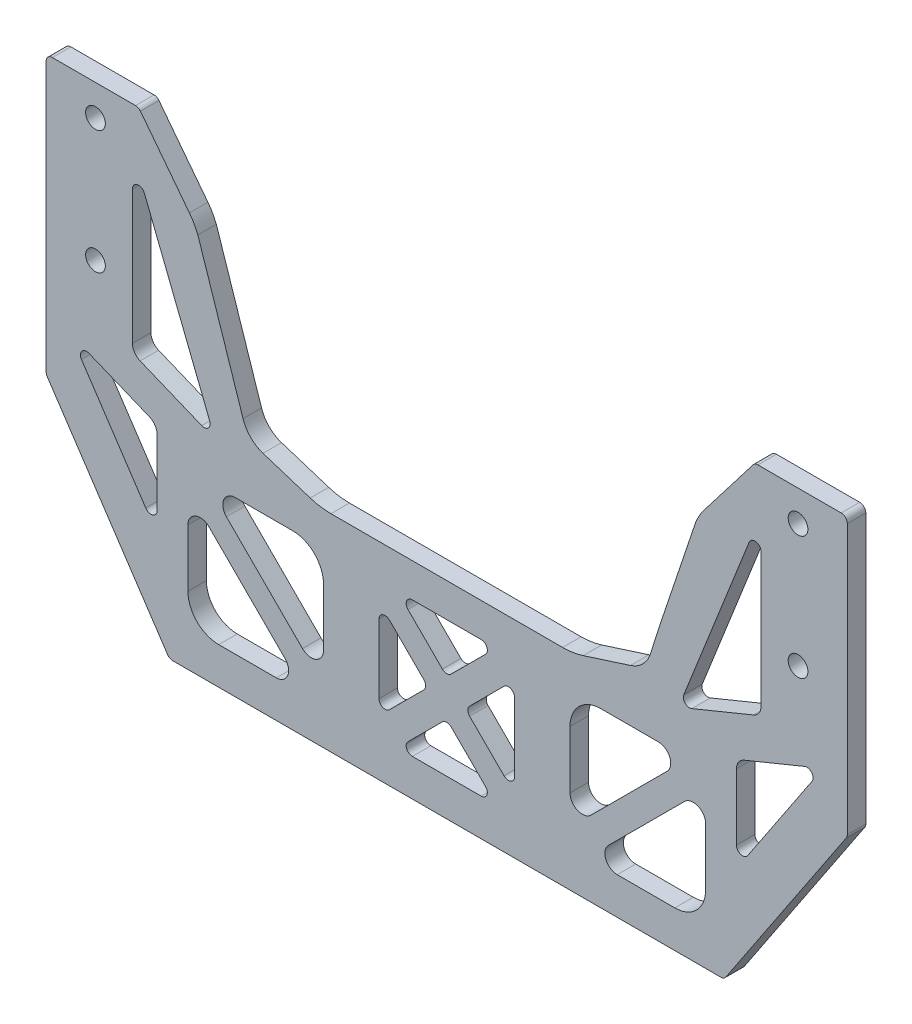
from build123d import *

# Parameters (mm, degrees)
SKETCH_1_W              = 130
SKETCH_1_H              = 75
EXTRUDE_1_DEPTH         = 3
CHAMFER_1_SIZE          = 20
CHAMFER_1_SIZE2         = 30
CHAMFER_2_SIZE          = 30
CHAMFER_2_SIZE2         = 20
SKETCH_2_R              = 1.6
CUT_EXTRUDE_1_DEPTH     = 76.101597853
CUT_EXTRUDE_2_DEPTH     = 76.101597853
CHAMFER_3_SIZE          = 10
FILLET_2_R              = 5
CUT_EXTRUDE_6_DEPTH     = 10
FILLET_5_R              = 10
SKETCH_11_W             = 22
SKETCH_11_H             = 22
CUT_EXTRUDE_7_DEPTH     = 10
FILLET_6_R              = 5
EXTRUDE_2_DEPTH         = 3
FILLET_7_R              = 1
CUT_EXTRUDE_8_DEPTH     = 10
FILLET_8_R              = 1
FILLET_9_R              = 2
FILLET_8_OF_MIRROR_1_R  = 1
FILLET_9_OF_MIRROR_1_R  = 2
EXTRUDE_3_DEPTH         = 3
FILLET_10_DEPTH         = 3
CUT_EXTRUDE_9_DEPTH     = 10
FILLET_11_R             = 4
FILLET_11_OF_MIRROR_3_R = 4
FILLET_12_R             = 1
CUT_EXTRUDE_10_DEPTH    = 10
CUT_EXTRUDE_11_DEPTH    = 10


with BuildPart() as part:
    # 草图1 → 凸台-拉伸1 (new body)
    with BuildSketch(Plane.XY):
        Rectangle(SKETCH_1_W, SKETCH_1_H)
    extrude(amount=EXTRUDE_1_DEPTH)

    # 倒角1
    chamfer_1_edges = [part.edges().sort_by_distance(p)[0] for p in [
        (65, -37.5, 1.5),
    ]]
    chamfer_1_side = [part.faces().sort_by_distance(p)[0] for p in [
        (0, -37.5, 1.5),
    ]]
    chamfer(chamfer_1_edges, length=CHAMFER_1_SIZE, length2=CHAMFER_1_SIZE2, reference=chamfer_1_side[0])

    # 倒角2
    chamfer_2_edges = [part.edges().sort_by_distance(p)[0] for p in [
        (-65, -37.5, 1.5),
    ]]
    chamfer_2_side = [part.faces().sort_by_distance(p)[0] for p in [
        (-65, 0, 1.5),
    ]]
    chamfer(chamfer_2_edges, length=CHAMFER_2_SIZE, length2=CHAMFER_2_SIZE2, reference=chamfer_2_side[0])

    # 草图2 → 切除-拉伸1 (cut, through all)
    with BuildSketch(Plane.XY.offset(3)):
        with Locations((57, 32.5)):
            Circle(SKETCH_2_R)
        with Locations((57, 12.5)):
            Circle(SKETCH_2_R)
        with Locations(Location((-57, 12.5, 0), (0, 0, 180))):
            Circle(SKETCH_2_R)
        with Locations(Location((-57, 32.5, 0), (0, 0, 180))):
            Circle(SKETCH_2_R)
    extrude(amount=-CUT_EXTRUDE_1_DEPTH, mode=Mode.SUBTRACT)

    # 草图3 → 切除-拉伸2 (cut, through all)
    with BuildSketch(Plane.XY.offset(3)):
        Polygon((-50, 37.5), (-25, 5), (25, 5), (50, 37.5), align=None)
    extrude(amount=-CUT_EXTRUDE_2_DEPTH, mode=Mode.SUBTRACT)

    # 倒角3
    chamfer_3_edges = [part.edges().sort_by_distance(p)[0] for p in [
        (25, 5, 1.5),
        (-25, 5, 1.5),
    ]]
    chamfer(chamfer_3_edges, length=CHAMFER_3_SIZE)

    # 圆角2
    fillet_2_edges = [part.edges().sort_by_distance(p)[0] for p in [
        (31.097107608, 12.926239891, 1.5),
        (-15, 5, 1.5),
        (15, 5, 1.5),
        (-31.097107608, 12.926239891, 1.5),
    ]]
    fillet(fillet_2_edges, radius=FILLET_2_R)

    # 草图9 → 切除-拉伸6 (cut)
    with BuildSketch(Plane(origin=(0, 0, 0), x_dir=(-1, 0, 0), z_dir=(0, 0, -1))):
        Polygon((-8.056483751, -3), (8.056483751, -3), (22, -3), (32.5, 4.5), (40.903484361, 25.67452967), (-40.903484361, 25.67452967), (-32.5, 4.5), (-22, -3), align=None)
    extrude(amount=-CUT_EXTRUDE_6_DEPTH, mode=Mode.SUBTRACT)

    # 圆角5
    fillet_5_edges = [part.edges().sort_by_distance(p)[0] for p in [
        (-40.903484361, 25.67452967, 1.5),
        (22, -3, 1.5),
        (32.5, 4.5, 1.5),
        (40.903484361, 25.67452967, 1.5),
        (-32.5, 4.5, 1.5),
        (-22, -3, 1.5),
    ]]
    fillet(fillet_5_edges, radius=FILLET_5_R)

    # 草图11 → 切除-拉伸7 (cut)
    with BuildSketch(Plane(origin=(0, 0, 0), x_dir=(-1, 0, 0), z_dir=(0, 0, -1))):
        with Locations((0, -20.5)):
            Rectangle(SKETCH_11_W, SKETCH_11_H)
        with Locations((31, -20.5)):
            Rectangle(SKETCH_11_W, SKETCH_11_H)
        with Locations((-31, -20.5)):
            Rectangle(SKETCH_11_W, SKETCH_11_H)
    extrude(amount=-CUT_EXTRUDE_7_DEPTH, mode=Mode.SUBTRACT)

    # 圆角6
    fillet_6_edges = [part.edges().sort_by_distance(p)[0] for p in [
        (20, -9.5, 1.5),
        (20, -31.5, 1.5),
        (42, -31.5, 1.5),
        (42, -9.5, 1.5),
        (-42, -9.5, 1.5),
        (-42, -31.5, 1.5),
        (-20, -31.5, 1.5),
        (-20, -9.5, 1.5),
    ]]
    fillet(fillet_6_edges, radius=FILLET_6_R)

    # 草图12 → 凸台-拉伸2 (add)
    with BuildSketch(Plane.XY.offset(3)):
        Polygon((0, -17.5), (-8, -9.5), (-11, -12.5), (-3, -20.5), align=None)
        Polygon((-11, -12.5), (-8, -9.5), (-11, -9.5), align=None)
        Polygon((3, -20.5), (0, -17.5), (-3, -20.5), (0, -23.5), align=None)
        Polygon((11, -28.5), (3, -20.5), (0, -23.5), (8, -31.5), align=None)
        Polygon((8, -9.5), (0, -17.5), (3, -20.5), (11, -12.5), align=None)
        Polygon((11, -9.5), (8, -9.5), (11, -12.5), align=None)
        Polygon((11, -31.5), (11, -28.5), (8, -31.5), align=None)
        Polygon((0, -23.5), (-3, -20.5), (-11, -28.5), (-8, -31.5), align=None)
        Polygon((-8, -31.5), (-11, -28.5), (-11, -31.5), align=None)
    extrude(amount=-EXTRUDE_2_DEPTH)

    # 圆角7
    fillet_7_edges = [part.edges().sort_by_distance(p)[0] for p in [
        (-3, -20.5, 1.5),
        (-11, -12.5, 1.5),
        (-8, -9.5, 1.5),
        (0, -17.5, 1.5),
        (8, -9.5, 1.5),
        (11, -12.5, 1.5),
        (3, -20.5, 1.5),
        (11, -28.5, 1.5),
        (8, -31.5, 1.5),
        (0, -23.5, 1.5),
        (-8, -31.5, 1.5),
        (-11, -28.5, 1.5),
    ]]
    fillet(fillet_7_edges, radius=FILLET_7_R)

    # 草图13 → 切除-拉伸8 (cut)
    with BuildSketch(Plane.XY.offset(3)):
        Polygon((-51, 2.5), (-51, 30.783196083), (-37.592544704, -3), align=None)
        Polygon((-61.08823586, 0.153171073), (-47, -5.626098409), (-47, -20.979182717), align=None)
    cut_extrude_8 = extrude(amount=-CUT_EXTRUDE_8_DEPTH, mode=Mode.SUBTRACT)

    # 圆角8
    fillet_8_edges = [part.edges().sort_by_distance(p)[0] for p in [
        (-47, -20.979182717, 1.5),
        (-61.08823586, 0.153171073, 1.5),
        (-37.592544704, -3, 1.5),
        (-51, 30.783196083, 1.5),
    ]]
    fillet(fillet_8_edges, radius=FILLET_8_R)

    # 圆角9
    fillet_9_edges = [part.edges().sort_by_distance(p)[0] for p in [
        (-47, -5.626098409, 1.5),
        (-51, 2.5, 1.5),
    ]]
    fillet(fillet_9_edges, radius=FILLET_9_R)

    # 镜向1: 切除-拉伸8 across plane
    add(cut_extrude_8.mirror(Plane(origin=(0, 0, 0), x_dir=(0, 0, 1), z_dir=(1, 0, 0))), mode=Mode.SUBTRACT)

    # 圆角8 of 镜向1
    fillet_8_of_mirror_1_edges = [part.edges().sort_by_distance(p)[0] for p in [
        (47, -20.979182717, 1.5),
        (61.08823586, 0.153171073, 1.5),
        (37.592544704, -3, 1.5),
        (51, 30.783196083, 1.5),
    ]]
    fillet(fillet_8_of_mirror_1_edges, radius=FILLET_8_OF_MIRROR_1_R)

    # 圆角9 of 镜向1
    fillet_9_of_mirror_1_edges = [part.edges().sort_by_distance(p)[0] for p in [
        (47, -5.626098409, 1.5),
        (51, 2.5, 1.5),
    ]]
    fillet(fillet_9_of_mirror_1_edges, radius=FILLET_9_OF_MIRROR_1_R)

    # 草图14 → 凸台-拉伸3 (add)
    with BuildSketch(Plane.XY.offset(3)):
        with BuildLine():
            Line((41.654583912, -12.673843213), (23.173843213, -31.154583912))
            ThreePointArc((23.173843213, -31.154583912), (21.464466094, -30.035533906), (20.345416088, -28.326156787))
            Line((20.345416088, -28.326156787), (38.826156787, -9.845416088))
            ThreePointArc((38.826156787, -9.845416088), (40.535533906, -10.964466094), (41.654583912, -12.673843213))
        make_face()
    extrude_3 = extrude(amount=-EXTRUDE_3_DEPTH)

    # 镜向2: 凸台-拉伸3 across plane
    add(extrude_3.mirror(Plane(origin=(0, 0, 0), x_dir=(0, 0, 1), z_dir=(1, 0, 0))))

    # 圆角10: read off the stored shape, not the designer's step
    # 圆角10 outline → 圆角10 (add)
    with BuildSketch(Plane.XY):
        with BuildLine():
            ThreePointArc((27.656854249, -31.5), (25.809095184, -30.265366865), (26.242640687, -28.085786438))
            Line((26.242640687, -28.085786438), (23.173843213, -31.154583912))
            ThreePointArc((23.173843213, -31.154583912), (24.070731352, -31.412887112), (25, -31.5))
            Line((25, -31.5), (27.656854249, -31.5))
        make_face()
        with BuildLine():
            ThreePointArc((38.585786438, -15.742640687), (40.765366865, -15.309095184), (42, -17.156854249))
            Line((42, -17.156854249), (42, -14.5))
            ThreePointArc((42, -14.5), (41.912887112, -13.570731352), (41.654583912, -12.673843213))
            Line((41.654583912, -12.673843213), (38.585786438, -15.742640687))
        make_face()
        with BuildLine():
            ThreePointArc((34.343145751, -9.5), (36.190904816, -10.734633135), (35.757359313, -12.914213562))
            Line((35.757359313, -12.914213562), (38.826156787, -9.845416088))
            ThreePointArc((38.826156787, -9.845416088), (37.929268648, -9.587112888), (37, -9.5))
            Line((37, -9.5), (34.343145751, -9.5))
        make_face()
        with BuildLine():
            ThreePointArc((23.414213562, -25.257359313), (21.234633135, -25.690904816), (20, -23.843145751))
            Line((20, -23.843145751), (20, -26.5))
            ThreePointArc((20, -26.5), (20.087112888, -27.429268648), (20.345416088, -28.326156787))
            Line((20.345416088, -28.326156787), (23.414213562, -25.257359313))
        make_face()
        with BuildLine():
            Line((-23.173843213, -31.154583912), (-26.242640687, -28.085786438))
            ThreePointArc((-26.242640687, -28.085786438), (-25.809095184, -30.265366865), (-27.656854249, -31.5))
            Line((-27.656854249, -31.5), (-25, -31.5))
            ThreePointArc((-25, -31.5), (-24.070731352, -31.412887112), (-23.173843213, -31.154583912))
        make_face()
        with BuildLine():
            ThreePointArc((-42, -17.156854249), (-40.765366865, -15.309095184), (-38.585786438, -15.742640687))
            Line((-38.585786438, -15.742640687), (-41.654583912, -12.673843213))
            ThreePointArc((-41.654583912, -12.673843213), (-41.912887112, -13.570731352), (-42, -14.5))
            Line((-42, -14.5), (-42, -17.156854249))
        make_face()
        with BuildLine():
            Line((-20, -26.5), (-20, -23.843145751))
            ThreePointArc((-20, -23.843145751), (-21.234633135, -25.690904816), (-23.414213562, -25.257359313))
            Line((-23.414213562, -25.257359313), (-20.345416088, -28.326156787))
            ThreePointArc((-20.345416088, -28.326156787), (-20.087112888, -27.429268648), (-20, -26.5))
        make_face()
        with BuildLine():
            Line((-38.826156787, -9.845416088), (-35.757359313, -12.914213562))
            ThreePointArc((-35.757359313, -12.914213562), (-36.190904816, -10.734633135), (-34.343145751, -9.5))
            Line((-34.343145751, -9.5), (-37, -9.5))
            ThreePointArc((-37, -9.5), (-37.929268648, -9.587112888), (-38.826156787, -9.845416088))
        make_face()
    extrude(amount=FILLET_10_DEPTH)

    # 草图15 → 切除-拉伸9 (cut)
    with BuildSketch(Plane.XY.offset(3)):
        Polygon((33.586223757, 7.236992916), (31.475810078, 0.562702384), (21.847123776, -2.522955085), align=None)
    cut_extrude_9 = extrude(amount=-CUT_EXTRUDE_9_DEPTH, mode=Mode.SUBTRACT)

    # 圆角11
    fillet_11_edges = [part.edges().sort_by_distance(p)[0] for p in [
        (31.475810078, 0.562702384, 1.5),
    ]]
    fillet(fillet_11_edges, radius=FILLET_11_R)

    # 镜向3: 切除-拉伸9 across plane
    add(cut_extrude_9.mirror(Plane(origin=(0, 0, 0), x_dir=(0, 0, 1), z_dir=(1, 0, 0))), mode=Mode.SUBTRACT)

    # 圆角11 of 镜向3
    fillet_11_of_mirror_3_edges = [part.edges().sort_by_distance(p)[0] for p in [
        (-31.475810078, 0.562702384, 1.5),
    ]]
    fillet(fillet_11_of_mirror_3_edges, radius=FILLET_11_OF_MIRROR_3_R)

    # 圆角12
    fillet_12_edges = [part.edges().sort_by_distance(p)[0] for p in [
        (65, -7.5, 1.5),
        (-33.586223757, 7.236992916, 1.5),
        (33.586223757, 7.236992916, 1.5),
        (45, -37.5, 1.5),
        (-45, -37.5, 1.5),
        (-65, -7.5, 1.5),
        (-50, 37.5, 1.5),
        (50, 37.5, 1.5),
        (-65, 37.5, 1.5),
        (65, 37.5, 1.5),
    ]]
    fillet(fillet_12_edges, radius=FILLET_12_R)

    # 草图16 → 切除-拉伸10 (cut)
    with BuildSketch(Plane.XY.offset(3)):
        with BuildLine():
            Line((-34.528903423, 6.901380027), (-33.052840085, 2.233254695))
            ThreePointArc((-33.052840085, 2.233254695), (-31.827862137, 0.21201091), (-29.81137686, -1.020784506))
            Line((-29.81137686, -1.020784506), (-22.152301207, -3.475250594))
            ThreePointArc((-22.152301207, -3.475250594), (-20.494208416, -3.868020899), (-18.795349466, -4))
            Line((-18.795349466, -4), (18.795349466, -4))
            ThreePointArc((18.795349466, -4), (20.494208416, -3.868020899), (22.152301207, -3.475250594))
            Line((22.152301207, -3.475250594), (29.81137686, -1.020784506))
            ThreePointArc((29.81137686, -1.020784506), (31.827862137, 0.21201091), (33.052840085, 2.233254695))
            Line((33.052840085, 2.233254695), (34.528903423, 6.901380027))
            Line((34.528903423, 6.901380027), (40.387616156, 24.37467997))
            Line((40.387616156, 24.37467997), (33.586223757, 7.236992916))
            Line((33.586223757, 7.236992916), (32.099370009, 2.534742363))
            ThreePointArc((32.099370009, 2.534742363), (31.119387651, 0.917747336), (29.506199429, -0.068488997))
            Line((29.506199429, -0.068488997), (21.847123776, -2.522955085))
            ThreePointArc((21.847123776, -2.522955085), (20.339766693, -2.880018999), (18.795349466, -3))
            Line((18.795349466, -3), (-18.795349466, -3))
            ThreePointArc((-18.795349466, -3), (-20.339766693, -2.880018999), (-21.847123776, -2.522955085))
            Line((-21.847123776, -2.522955085), (-29.506199429, -0.068488997))
            ThreePointArc((-29.506199429, -0.068488997), (-31.119387651, 0.917747336), (-32.099370009, 2.534742363))
            Line((-32.099370009, 2.534742363), (-33.575433347, 7.202867695))
            Line((-33.575433347, 7.202867695), (-40.387616156, 24.37467997))
            Line((-40.387616156, 24.37467997), (-34.528903423, 6.901380027))
        make_face()
        with BuildLine():
            Line((-33.586223757, 7.236992916), (-33.599426154, 7.270259421))
            ThreePointArc((-33.599426154, 7.270259421), (-33.586826947, 7.236778169), (-33.575433347, 7.202867695))
            Line((-33.575433347, 7.202867695), (-33.586223757, 7.236992916))
        make_face()
    extrude(amount=-CUT_EXTRUDE_10_DEPTH, mode=Mode.SUBTRACT)


with BuildPart() as cut_extrude_10_piece_1:
    # of the separate pieces the step leaves, piece 1, a body of its own (cut_extrude_10_pieces)
    add(part.part.solids().sort_by_distance((-49.699777508, 37.109710761, 0))[0])


with BuildPart() as cut_extrude_10_piece_2:
    # of the separate pieces the step leaves, piece 2, a body of its own (cut_extrude_10_pieces)
    add(part.part.solids().sort_by_distance((-33.575433347, 7.202867695, 0))[0])


with BuildPart() as cut_extrude_11_tool:
    # 草图17 → 切除-拉伸11 (new body)
    with BuildSketch(Plane.XY.offset(3)):
        Polygon((-40.387616156, 24.37467997), (-33.052840085, 2.233254695), (0, 0), align=None)
    extrude(amount=-CUT_EXTRUDE_11_DEPTH)


with BuildPart() as cut_extrude_10_piece_1_1:
    add(cut_extrude_10_piece_1.part)

    # 切除-拉伸11: cut by cut_extrude_11_tool
    add(cut_extrude_11_tool.part, mode=Mode.SUBTRACT)


with BuildPart() as cut_extrude_10_piece_2_1:
    add(cut_extrude_10_piece_2.part)

    # 切除-拉伸11: cut by cut_extrude_11_tool
    add(cut_extrude_11_tool.part, mode=Mode.SUBTRACT)


solid = cut_extrude_10_piece_1_1.part
